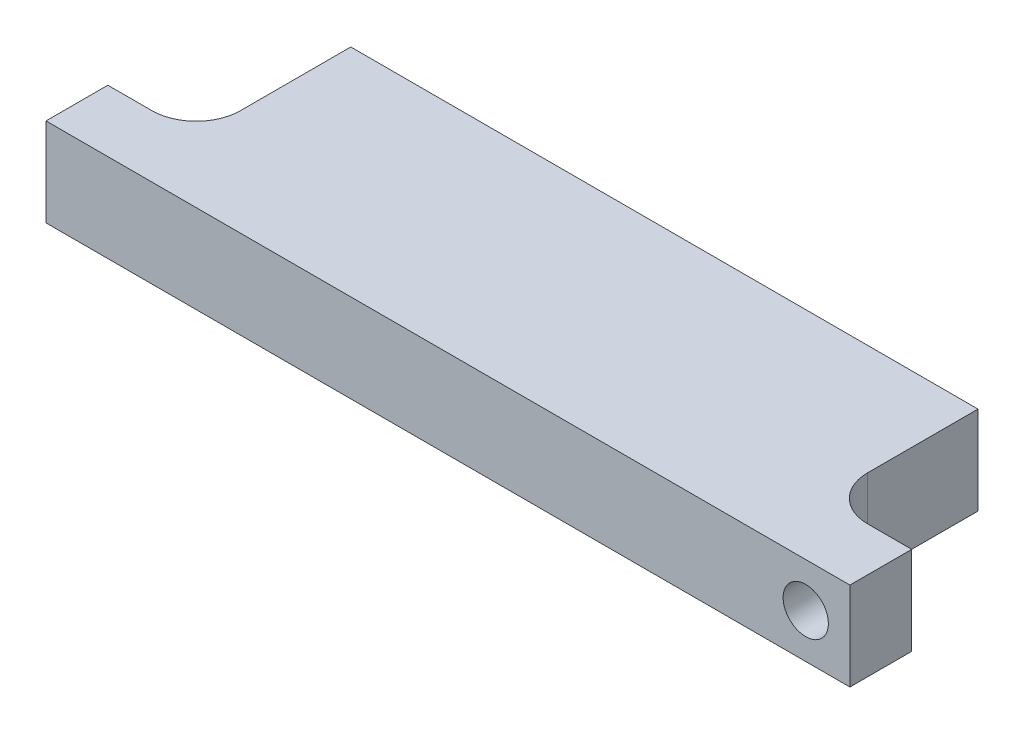
from build123d import *

# Parameters (mm, degrees)
SKETCH1_W                    = 36.4
SKETCH1_H                    = 9.8
BOSS_EXTRUDE1_DEPTH          = 4
SKETCH2_W                    = 4
SKETCH2_H                    = 6.999999999
CUT_EXTRUDE1_DEPTH           = 22.05421573
SKETCH3_W                    = 4
SKETCH3_H                    = 6.999999999
CUT_EXTRUDE2_DEPTH           = 22.05421573
M2_5X0_45_TAPPED_HOLE1_D     = 2.05
M2_5X0_45_TAPPED_HOLE1_DEPTH = 6.35
M2_5X0_45_TAPPED_HOLE1_TIP   = 0.615882135
M2_5X0_45_TAPPED_HOLE2_D     = 2.05
FILLET1_R                    = 2


with BuildPart() as part:
    # Sketch1 → Boss-Extrude1 (new body)
    with BuildSketch(Plane(origin=(0, 4, 0), x_dir=(1, 0, 0), z_dir=(0, 1, 0))):
        with Locations((0, -4.9)):
            Rectangle(SKETCH1_W, SKETCH1_H)
    extrude(amount=-BOSS_EXTRUDE1_DEPTH)

    # Sketch2 → Cut-Extrude1 (cut, through all)
    with BuildSketch(Plane.XZ):
        with Locations((-16.2, 3.5)):
            Rectangle(SKETCH2_W, SKETCH2_H)
    extrude(amount=-CUT_EXTRUDE1_DEPTH, mode=Mode.SUBTRACT)

    # Sketch3 → Cut-Extrude2 (cut, through all)
    with BuildSketch(Plane.XZ):
        with Locations((16.2, 3.5)):
            Rectangle(SKETCH3_W, SKETCH3_H)
    extrude(amount=-CUT_EXTRUDE2_DEPTH, mode=Mode.SUBTRACT)

    # M2.5x0.45 Tapped Hole1
    with Locations(Plane(origin=(0, 0, 0), x_dir=(-1, 0, 0), z_dir=(0, 0, -1))):
        with Locations((10, 2), (-10, 2)):
            Hole(M2_5X0_45_TAPPED_HOLE1_D / 2, depth=M2_5X0_45_TAPPED_HOLE1_DEPTH)
            with Locations((0, 0, -(M2_5X0_45_TAPPED_HOLE1_DEPTH + M2_5X0_45_TAPPED_HOLE1_TIP / 2))):  # 118° drill point
                Cone(0, M2_5X0_45_TAPPED_HOLE1_D / 2, M2_5X0_45_TAPPED_HOLE1_TIP, mode=Mode.SUBTRACT)

    # M2.5x0.45 Tapped Hole2 (through all)
    with Locations(Plane.XY.offset(9.8)):
        with Locations((16.2, 2)):
            Hole(M2_5X0_45_TAPPED_HOLE2_D / 2)

    # Fillet1
    # the kernel refuses this fillet: 2 mm, written as the material it adds along each edge
    with BuildSketch(Plane(origin=(-14.2, 0, 6.999999999), x_dir=(0, 0, -1), z_dir=(0, 1, 0))) as fillet1_piece_1:
        with BuildLine():
            CenterArc((FILLET1_R, FILLET1_R), FILLET1_R, 180, 90)
            Line((0, FILLET1_R), (0, 0))
            Line((0, 0), (FILLET1_R, 0))
        make_face()
    extrude(amount=4)
    with BuildSketch(Plane(origin=(14.2, 0, 6.999999999), x_dir=(0, 0, -1), z_dir=(0, 1, 0))) as fillet1_piece_2_section:
        with BuildLine():
            CenterArc((FILLET1_R, -FILLET1_R), FILLET1_R, 90, 90)
            Line((0, -FILLET1_R), (0, 0))
            Line((0, 0), (FILLET1_R, 0))
        make_face()
    fillet1_piece_2 = extrude(amount=4, mode=Mode.PRIVATE)
    fillet1_piece_2 = fillet1_piece_2 - Plane(origin=(16.2, 2, 6.528177275), x_dir=(-1, 0, 0), z_dir=(0, 0, -1)) * Cylinder(1.025, 16, mode=Mode.PRIVATE)
    add(fillet1_piece_2)


solid = part.part
